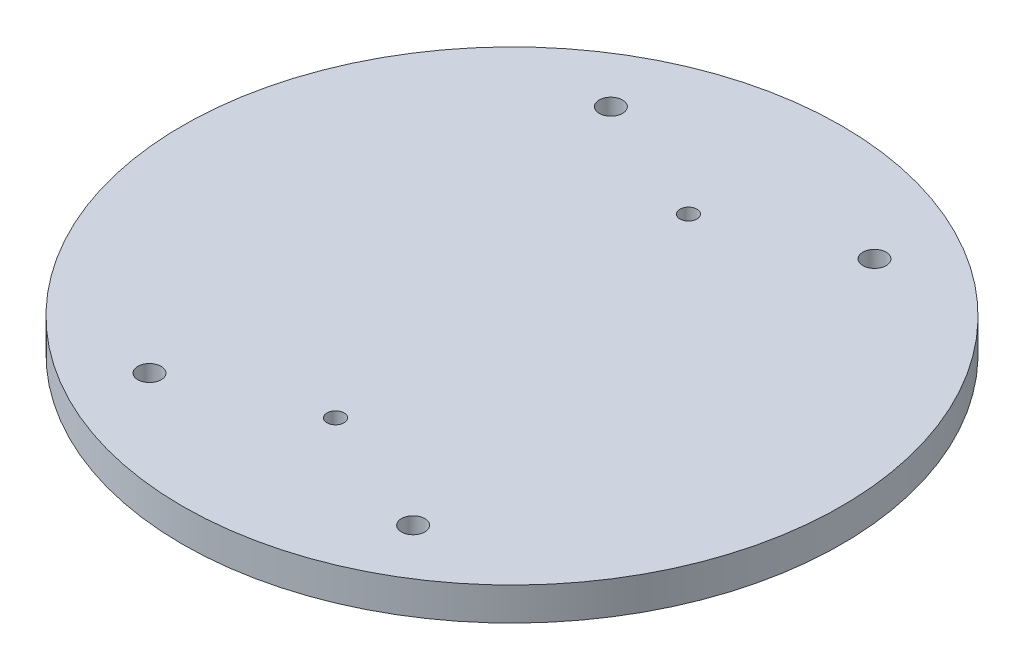
from build123d import *

# Parameters (mm, degrees)
SKETCH1_R                   = 63.5
BOSS_EXTRUDE1_DEPTH         = 6.35
F_8_CLEARANCE_HOLE1_D       = 4.4958
TAP_DRILL_FOR_M4X0_7_TAP1_D = 3.3


with BuildPart() as part:
    # Sketch1 → Boss-Extrude1 (new body)
    with BuildSketch(Plane(origin=(0, 0, 0), x_dir=(1, 0, 0), z_dir=(0, 1, 0))):
        Circle(SKETCH1_R)
    extrude(amount=BOSS_EXTRUDE1_DEPTH)

    # #8 Clearance Hole1 (through all)
    with Locations(Plane(origin=(0, 6.35, 0), x_dir=(1, 0, 0), z_dir=(0, 1, 0))):
        with Locations((-25.4, -44.45), (25.4, -44.45), (25.4, 44.45), (-25.4, 44.45)):
            Hole(F_8_CLEARANCE_HOLE1_D / 2)

    # Tap Drill for M4x0.7 Tap1 (through all)
    with Locations(Plane(origin=(0, 6.35, 0), x_dir=(1, 0, 0), z_dir=(0, 1, 0))):
        with Locations((0, 34), (0, -34)):
            Hole(TAP_DRILL_FOR_M4X0_7_TAP1_D / 2)


solid = part.part
